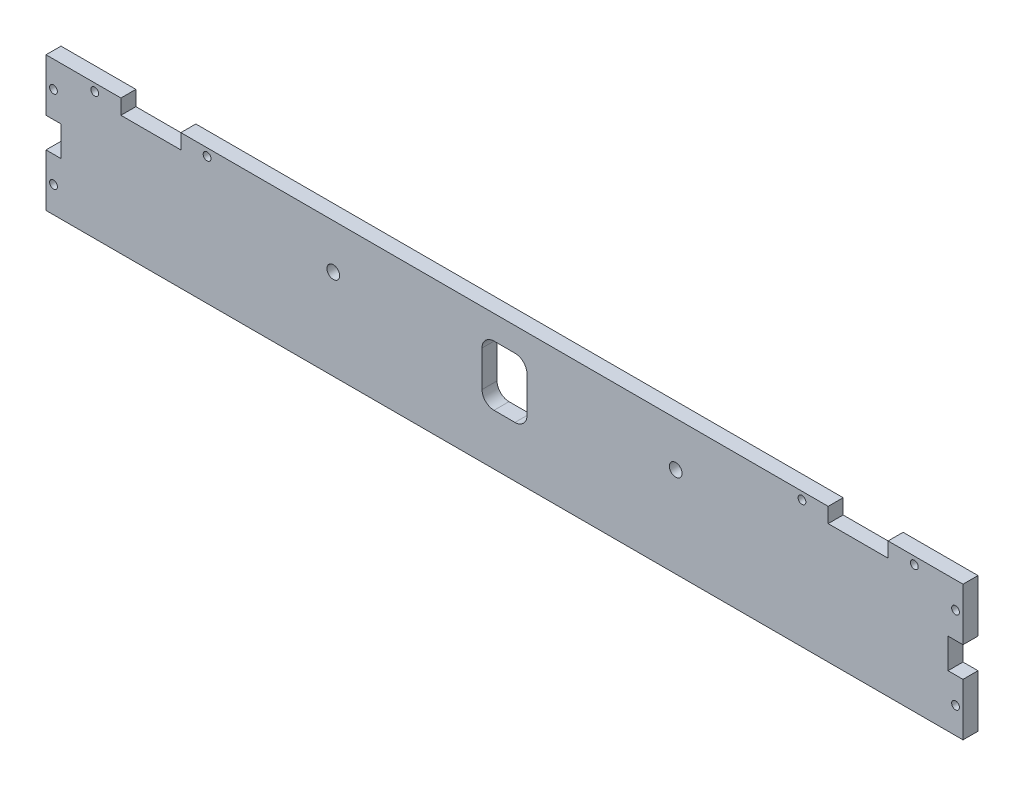
from build123d import *

# Parameters (mm, degrees)
SKETCH1_R           = 1.65
SKETCH1_R_2         = 2.7
BOSS_EXTRUDE1_DEPTH = 6.35


with BuildPart() as part:
    # Sketch1 → Boss-Extrude1 (new body)
    with BuildSketch(Plane(origin=(0, 0, 215.9), x_dir=(-1, 0, 0), z_dir=(0, 0, -1))):
        Polygon((50.8, 57.15), (50.8, 50.8), (25.4, 50.8), (25.4, 57.15), (-6.35, 57.15), (-6.35, 34.925), (0, 34.925), (0, 22.225), (-6.35, 22.225), (-6.35, 0), (382.27, 0), (382.27, 22.225), (375.92, 22.225), (375.92, 34.925), (382.27, 34.925), (382.27, 57.15), (350.52, 57.15), (350.52, 50.8), (325.12, 50.8), (325.12, 57.15), align=None)
        with Locations((379.095, 11.1125)):
            Circle(SKETCH1_R, mode=Mode.SUBTRACT)
        with Locations((-3.175, 11.1125)):
            Circle(SKETCH1_R, mode=Mode.SUBTRACT)
        with Locations((379.095, 46.037500912)):
            Circle(SKETCH1_R, mode=Mode.SUBTRACT)
        with Locations((-3.175, 46.037500912)):
            Circle(SKETCH1_R, mode=Mode.SUBTRACT)
        with Locations((314.0075, 53.975)):
            Circle(SKETCH1_R, mode=Mode.SUBTRACT)
        with Locations((61.9125, 53.975)):
            Circle(SKETCH1_R, mode=Mode.SUBTRACT)
        with Locations((361.6325, 53.975)):
            Circle(SKETCH1_R, mode=Mode.SUBTRACT)
        with Locations((14.2875, 53.975)):
            Circle(SKETCH1_R, mode=Mode.SUBTRACT)
        with Locations((260.51, 38.26)):
            Circle(SKETCH1_R_2, mode=Mode.SUBTRACT)
        with Locations((115.41, 38.26)):
            Circle(SKETCH1_R_2, mode=Mode.SUBTRACT)
        with BuildLine():
            Line((192.405, 21.59), (183.515, 21.59))
            ThreePointArc((183.515, 21.59), (179.922897552, 23.077897552), (178.435, 26.67))
            Line((178.435, 26.67), (178.435, 41.91))
            ThreePointArc((178.435, 41.91), (179.922897552, 45.502102448), (183.515, 46.99))
            Line((183.515, 46.99), (192.405, 46.99))
            ThreePointArc((192.405, 46.99), (195.997102448, 45.502102448), (197.485, 41.91))
            Line((197.485, 41.91), (197.485, 26.67))
            ThreePointArc((197.485, 26.67), (195.997102448, 23.077897552), (192.405, 21.59))
        make_face(mode=Mode.SUBTRACT)
    extrude(amount=-BOSS_EXTRUDE1_DEPTH)


solid = part.part
